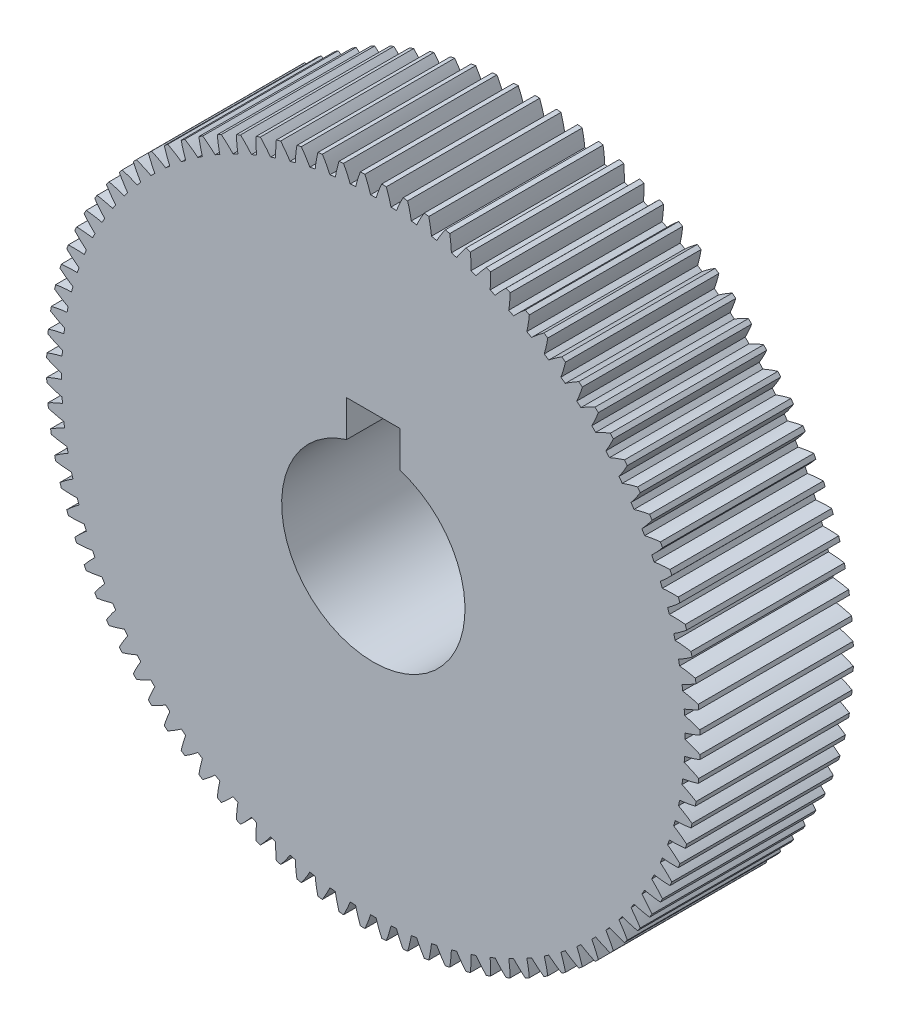
from build123d import *

# Parameters (mm, degrees)
EXTRUDE_1_DEPTH     = 46
CUT_EXTRUDE_1_DEPTH = 90


with BuildPart() as part:
    # Model → 凸台-拉伸1 (new body)
    with BuildSketch(Plane.XY):
        with BuildLine():
            ThreePointArc((-97.967489432, 2.524086835), (-95.758100973, 1.600439791), (-93.495436524, 0.816302804))
            ThreePointArc((-93.495436524, 0.816302804), (-93.499, 0), (-93.495436524, -0.816302804))
            ThreePointArc((-93.495436524, -0.816302804), (-95.758100973, -1.600439791), (-97.967489432, -2.524086835))
            ThreePointArc((-97.967489432, -2.524086835), (-97.947529573, -3.206470117), (-97.922816695, -3.8886978))
            ThreePointArc((-97.922816695, -3.8886978), (-95.657749299, -4.665866327), (-93.348644375, -5.300339081))
            ThreePointArc((-93.348644375, -5.300339081), (-93.298811464, -6.11512718), (-93.241866859, -6.929449154))
            ThreePointArc((-93.241866859, -6.929449154), (-95.448401758, -7.859892579), (-97.59265034, -8.926062943))
            ThreePointArc((-97.59265034, -8.926062943), (-97.528103214, -9.605679752), (-97.458823423, -10.284830434))
            ThreePointArc((-97.458823423, -10.284830434), (-95.147776456, -10.912192488), (-92.802119, -11.394284099))
            ThreePointArc((-92.802119, -11.394284099), (-92.699103094, -12.204068446), (-92.589021207, -13.012922539))
            ThreePointArc((-92.589021207, -13.012922539), (-94.729977833, -14.085688101), (-96.799904536, -15.289816279))
            ThreePointArc((-96.799904536, -15.289816279), (-96.691046544, -15.963756393), (-96.577496507, -16.636921846))
            ThreePointArc((-96.577496507, -16.636921846), (-94.230366228, -17.111790966), (-91.858200704, -17.439437044))
            ThreePointArc((-91.858200704, -17.439437044), (-91.702442932, -18.240750018), (-91.53969515, -19.040672593))
            ThreePointArc((-91.53969515, -19.040672593), (-93.6059056, -20.251166543), (-95.59264668, -21.588096275))
            ThreePointArc((-95.59264668, -21.588096275), (-95.439943969, -22.253473777), (-95.282609924, -22.917771404))
            ThreePointArc((-95.282609924, -22.917771404), (-92.909447105, -23.238114127), (-90.52093149, -23.409911642))
            ThreePointArc((-90.52093149, -23.409911642), (-90.313098832, -24.199321898), (-90.098382066, -24.986887563))
            ThreePointArc((-90.098382066, -24.986887563), (-92.080998508, -26.329926382), (-93.976046435, -27.793932728))
            ThreePointArc((-93.976046435, -27.793932728), (-93.780152902, -28.447898371), (-93.579708577, -29.100483546))
            ThreePointArc((-93.579708577, -29.100483546), (-91.190675465, -29.264928117), (-88.796037751, -29.280141405))
            ThreePointArc((-88.796037751, -29.280141405), (-88.537020178, -30.054268566), (-88.271253878, -30.826104844))
            ThreePointArc((-88.271253878, -30.826104844), (-90.161786444, -32.295937433), (-91.957026332, -33.880751294))
            ThreePointArc((-91.957026332, -33.880751294), (-91.718780822, -34.520504696), (-91.476084552, -35.158582951))
            ThreePointArc((-91.476084552, -35.158582951), (-89.081411354, -35.166425192), (-86.690905746, -35.024989107))
            ThreePointArc((-86.690905746, -35.024989107), (-86.38181241, -35.780518243), (-86.066134629, -36.533320012))
            ThreePointArc((-86.066134629, -36.533320012), (-87.856487769, -38.123652323), (-89.544232124, -39.822487281))
            ThreePointArc((-89.544232124, -39.822487281), (-89.264654842, -40.445288921), (-88.980745889, -41.066127905))
            ThreePointArc((-88.980745889, -41.066127905), (-86.590686963, -40.917334235), (-84.214549974, -40.619854428))
            ThreePointArc((-84.214549974, -40.619854428), (-83.856704461, -41.353550247), (-83.492466978, -42.084093895))
            ThreePointArc((-83.492466978, -42.084093895), (-85.174974125, -43.78811588), (-86.747995768, -45.593697265))
            ThreePointArc((-86.747995768, -45.593697265), (-86.428283906, -46.196880209), (-86.104378011, -46.797821395))
            ThreePointArc((-86.104378011, -46.797821395), (-83.729167956, -46.493028971), (-81.377574569, -46.040779297))
            ThreePointArc((-81.377574569, -46.040779297), (-80.972509228, -46.7495), (-80.561271766, -47.454657227))
            ThreePointArc((-80.561271766, -47.454657227), (-82.128728166, -49.265072003), (-83.580291176, -51.169668037))
            ThreePointArc((-83.580291176, -51.169668037), (-83.22181379, -51.750649364), (-82.859297968, -52.32911943))
            ThreePointArc((-82.859297968, -52.32911943), (-80.509107798, -51.869633419), (-78.192127897, -51.26455048))
            ThreePointArc((-78.192127897, -51.26455048), (-77.741577281, -51.945261217), (-77.28510082, -52.622012431))
            ThreePointArc((-77.28510082, -52.622012431), (-78.730794384, -54.531067523), (-80.054682945, -56.526522435))
            ThreePointArc((-80.054682945, -56.526522435), (-79.65897509, -57.082814293), (-79.25940169, -57.636336141))
            ThreePointArc((-79.25940169, -57.636336141), (-76.944295281, -57.024124134), (-74.671850529, -56.268798988))
            ThreePointArc((-74.671850529, -56.268798988), (-74.177743964, -56.918584851), (-73.677983207, -57.5640321))
            ThreePointArc((-73.677983207, -57.5640321), (-74.995723253, -59.563552641), (-76.186268272, -61.641321585))
            ThreePointArc((-76.186268272, -61.641321585), (-75.75502443, -62.170541848), (-75.320104486, -62.696745213))
            ThreePointArc((-75.320104486, -62.696745213), (-73.049995479, -61.934428794), (-70.831816834, -61.03209586))
            ThreePointArc((-70.831816834, -61.03209586), (-70.29627016, -61.648174366), (-69.755365159, -62.259553745))
            ThreePointArc((-69.755365159, -62.259553745), (-70.939508922, -64.340977483), (-71.991612302, -66.492163133))
            ThreePointArc((-71.991612302, -66.492163133), (-71.526679124, -66.992045598), (-71.058275031, -67.488677196))
            ThreePointArc((-71.058275031, -67.488677196), (-68.842884381, -66.579520723), (-66.688470424, -65.534043928))
            ThreePointArc((-66.688470424, -65.534043928), (-66.113776934, -66.113776934), (-65.534043928, -66.688470424))
            ThreePointArc((-65.534043928, -66.688470424), (-66.579520723, -68.842884381), (-67.488677196, -71.058275031))
            ThreePointArc((-67.488677196, -71.058275031), (-66.992045598, -71.526679124), (-66.492163133, -71.991612302))
            ThreePointArc((-66.492163133, -71.991612302), (-64.340977483, -70.939508922), (-62.259553746, -69.755365159))
            ThreePointArc((-62.259553746, -69.755365159), (-61.648174366, -70.296270159), (-61.03209586, -70.831816834))
            ThreePointArc((-61.03209586, -70.831816834), (-61.934428794, -73.049995479), (-62.696745213, -75.320104486))
            ThreePointArc((-62.696745213, -75.320104486), (-62.170541848, -75.75502443), (-61.641321585, -76.186268272))
            ThreePointArc((-61.641321585, -76.186268272), (-59.563552641, -74.995723253), (-57.5640321, -73.677983207))
            ThreePointArc((-57.5640321, -73.677983207), (-56.918584851, -74.177743964), (-56.268798988, -74.671850529))
            ThreePointArc((-56.268798988, -74.671850529), (-57.024124134, -76.944295281), (-57.636336141, -79.25940169))
            ThreePointArc((-57.636336141, -79.25940169), (-57.082814293, -79.65897509), (-56.526522435, -80.054682945))
            ThreePointArc((-56.526522435, -80.054682945), (-54.531067523, -78.730794384), (-52.622012431, -77.285100819))
            ThreePointArc((-52.622012431, -77.285100819), (-51.945261217, -77.741577281), (-51.26455048, -78.192127897))
            ThreePointArc((-51.26455048, -78.192127897), (-51.869633419, -80.509107798), (-52.32911943, -82.859297968))
            ThreePointArc((-52.32911943, -82.859297968), (-51.750649364, -83.22181379), (-51.169668037, -83.580291176))
            ThreePointArc((-51.169668037, -83.580291176), (-49.265072003, -82.128728166), (-47.454657227, -80.561271765))
            ThreePointArc((-47.454657227, -80.561271765), (-46.7495, -80.972509228), (-46.040779297, -81.377574569))
            ThreePointArc((-46.040779297, -81.377574569), (-46.493028971, -83.729167956), (-46.797821395, -86.104378011))
            ThreePointArc((-46.797821395, -86.104378011), (-46.196880209, -86.428283906), (-45.593697265, -86.747995768))
            ThreePointArc((-45.593697265, -86.747995768), (-43.78811588, -85.174974125), (-42.084093895, -83.492466978))
            ThreePointArc((-42.084093895, -83.492466978), (-41.353550247, -83.856704461), (-40.619854428, -84.214549974))
            ThreePointArc((-40.619854428, -84.214549974), (-40.917334235, -86.590686963), (-41.066127905, -88.980745888))
            ThreePointArc((-41.066127905, -88.980745888), (-40.445288921, -89.264654842), (-39.822487281, -89.544232124))
            ThreePointArc((-39.822487281, -89.544232124), (-38.123652323, -87.856487769), (-36.533320012, -86.066134629))
            ThreePointArc((-36.533320012, -86.066134629), (-35.780518243, -86.38181241), (-35.024989107, -86.690905746))
            ThreePointArc((-35.024989107, -86.690905746), (-35.166425192, -89.081411354), (-35.158582951, -91.476084552))
            ThreePointArc((-35.158582951, -91.476084552), (-34.520504696, -91.718780822), (-33.880751294, -91.957026332))
            ThreePointArc((-33.880751294, -91.957026332), (-32.295937434, -90.161786444), (-30.826104844, -88.271253878))
            ThreePointArc((-30.826104844, -88.271253878), (-30.054268566, -88.537020178), (-29.280141405, -88.796037751))
            ThreePointArc((-29.280141405, -88.796037751), (-29.264928117, -91.190675465), (-29.100483546, -93.579708577))
            ThreePointArc((-29.100483546, -93.579708577), (-28.447898371, -93.780152902), (-27.793932728, -93.976046435))
            ThreePointArc((-27.793932728, -93.976046435), (-26.329926382, -92.080998508), (-24.986887563, -90.098382066))
            ThreePointArc((-24.986887563, -90.098382066), (-24.199321898, -90.313098832), (-23.409911642, -90.52093149))
            ThreePointArc((-23.409911642, -90.52093149), (-23.238114128, -92.909447105), (-22.917771404, -95.282609924))
            ThreePointArc((-22.917771404, -95.282609924), (-22.253473777, -95.439943969), (-21.588096275, -95.59264668))
            ThreePointArc((-21.588096275, -95.59264668), (-20.251166543, -93.6059056), (-19.040672593, -91.53969515))
            ThreePointArc((-19.040672593, -91.53969515), (-18.240750018, -91.702442932), (-17.439437044, -91.858200704))
            ThreePointArc((-17.439437044, -91.858200704), (-17.111790966, -94.230366228), (-16.636921846, -96.577496507))
            ThreePointArc((-16.636921846, -96.577496507), (-15.963756393, -96.691046544), (-15.289816279, -96.799904536))
            ThreePointArc((-15.289816279, -96.799904536), (-14.085688101, -94.729977833), (-13.012922539, -92.589021207))
            ThreePointArc((-13.012922539, -92.589021207), (-12.204068446, -92.699103094), (-11.394284099, -92.802119))
            ThreePointArc((-11.394284099, -92.802119), (-10.912192488, -95.147776457), (-10.284830434, -97.458823423))
            ThreePointArc((-10.284830434, -97.458823423), (-9.605679752, -97.528103214), (-8.926062943, -97.59265034))
            ThreePointArc((-8.926062943, -97.59265034), (-7.859892579, -95.448401758), (-6.929449154, -93.241866859))
            ThreePointArc((-6.929449154, -93.241866859), (-6.11512718, -93.298811464), (-5.300339081, -93.348644375))
            ThreePointArc((-5.300339081, -93.348644375), (-4.665866327, -95.657749299), (-3.8886978, -97.922816695))
            ThreePointArc((-3.8886978, -97.922816695), (-3.206470117, -97.947529573), (-2.524086835, -97.967489432))
            ThreePointArc((-2.524086835, -97.967489432), (-1.600439791, -95.758100973), (-0.816302804, -93.495436524))
            ThreePointArc((-0.816302804, -93.495436524), (0, -93.499), (0.816302804, -93.495436524))
            ThreePointArc((0.816302804, -93.495436524), (1.600439791, -95.758100973), (2.524086835, -97.967489432))
            ThreePointArc((2.524086835, -97.967489432), (3.206470117, -97.947529573), (3.8886978, -97.922816695))
            ThreePointArc((3.8886978, -97.922816695), (4.665866327, -95.657749299), (5.300339081, -93.348644375))
            ThreePointArc((5.300339081, -93.348644375), (6.11512718, -93.298811464), (6.929449154, -93.241866859))
            ThreePointArc((6.929449154, -93.241866859), (7.859892579, -95.448401758), (8.926062943, -97.59265034))
            ThreePointArc((8.926062943, -97.59265034), (9.605679752, -97.528103214), (10.284830434, -97.458823423))
            ThreePointArc((10.284830434, -97.458823423), (10.912192488, -95.147776456), (11.394284099, -92.802119))
            ThreePointArc((11.394284099, -92.802119), (12.204068446, -92.699103094), (13.012922539, -92.589021207))
            ThreePointArc((13.012922539, -92.589021207), (14.085688101, -94.729977833), (15.289816279, -96.799904536))
            ThreePointArc((15.289816279, -96.799904536), (15.963756393, -96.691046544), (16.636921846, -96.577496507))
            ThreePointArc((16.636921846, -96.577496507), (17.111790966, -94.230366228), (17.439437044, -91.858200704))
            ThreePointArc((17.439437044, -91.858200704), (18.240750018, -91.702442932), (19.040672593, -91.53969515))
            ThreePointArc((19.040672593, -91.53969515), (20.251166543, -93.6059056), (21.588096275, -95.59264668))
            ThreePointArc((21.588096275, -95.59264668), (22.253473777, -95.439943969), (22.917771404, -95.282609924))
            ThreePointArc((22.917771404, -95.282609924), (23.238114127, -92.909447105), (23.409911642, -90.52093149))
            ThreePointArc((23.409911642, -90.52093149), (24.199321898, -90.313098832), (24.986887563, -90.098382066))
            ThreePointArc((24.986887563, -90.098382066), (26.329926382, -92.080998508), (27.793932728, -93.976046435))
            ThreePointArc((27.793932728, -93.976046435), (28.447898371, -93.780152902), (29.100483546, -93.579708577))
            ThreePointArc((29.100483546, -93.579708577), (29.264928117, -91.190675465), (29.280141405, -88.796037751))
            ThreePointArc((29.280141405, -88.796037751), (30.054268566, -88.537020178), (30.826104844, -88.271253878))
            ThreePointArc((30.826104844, -88.271253878), (32.295937433, -90.161786444), (33.880751294, -91.957026332))
            ThreePointArc((33.880751294, -91.957026332), (34.520504696, -91.718780822), (35.158582951, -91.476084552))
            ThreePointArc((35.158582951, -91.476084552), (35.166425192, -89.081411354), (35.024989107, -86.690905746))
            ThreePointArc((35.024989107, -86.690905746), (35.780518243, -86.38181241), (36.533320012, -86.066134629))
            ThreePointArc((36.533320012, -86.066134629), (38.123652323, -87.856487769), (39.822487281, -89.544232124))
            ThreePointArc((39.822487281, -89.544232124), (40.445288921, -89.264654842), (41.066127905, -88.980745889))
            ThreePointArc((41.066127905, -88.980745889), (40.917334235, -86.590686963), (40.619854428, -84.214549974))
            ThreePointArc((40.619854428, -84.214549974), (41.353550247, -83.856704461), (42.084093895, -83.492466978))
            ThreePointArc((42.084093895, -83.492466978), (43.78811588, -85.174974125), (45.593697265, -86.747995768))
            ThreePointArc((45.593697265, -86.747995768), (46.196880209, -86.428283906), (46.797821395, -86.104378011))
            ThreePointArc((46.797821395, -86.104378011), (46.493028971, -83.729167956), (46.040779297, -81.377574569))
            ThreePointArc((46.040779297, -81.377574569), (46.7495, -80.972509228), (47.454657227, -80.561271766))
            ThreePointArc((47.454657227, -80.561271766), (49.265072003, -82.128728166), (51.169668037, -83.580291176))
            ThreePointArc((51.169668037, -83.580291176), (51.750649364, -83.22181379), (52.32911943, -82.859297968))
            ThreePointArc((52.32911943, -82.859297968), (51.869633419, -80.509107798), (51.26455048, -78.192127897))
            ThreePointArc((51.26455048, -78.192127897), (51.945261217, -77.741577281), (52.622012431, -77.28510082))
            ThreePointArc((52.622012431, -77.28510082), (54.531067523, -78.730794384), (56.526522435, -80.054682945))
            ThreePointArc((56.526522435, -80.054682945), (57.082814293, -79.65897509), (57.636336141, -79.25940169))
            ThreePointArc((57.636336141, -79.25940169), (57.024124134, -76.944295281), (56.268798988, -74.671850529))
            ThreePointArc((56.268798988, -74.671850529), (56.918584851, -74.177743964), (57.5640321, -73.677983207))
            ThreePointArc((57.5640321, -73.677983207), (59.563552641, -74.995723253), (61.641321585, -76.186268272))
            ThreePointArc((61.641321585, -76.186268272), (62.170541848, -75.75502443), (62.696745213, -75.320104486))
            ThreePointArc((62.696745213, -75.320104486), (61.934428794, -73.049995479), (61.03209586, -70.831816834))
            ThreePointArc((61.03209586, -70.831816834), (61.648174366, -70.29627016), (62.259553745, -69.755365159))
            ThreePointArc((62.259553745, -69.755365159), (64.340977483, -70.939508922), (66.492163133, -71.991612302))
            ThreePointArc((66.492163133, -71.991612302), (66.992045598, -71.526679124), (67.488677196, -71.058275031))
            ThreePointArc((67.488677196, -71.058275031), (66.579520723, -68.842884381), (65.534043928, -66.688470424))
            ThreePointArc((65.534043928, -66.688470424), (66.113776934, -66.113776934), (66.688470424, -65.534043928))
            ThreePointArc((66.688470424, -65.534043928), (68.842884381, -66.579520723), (71.058275031, -67.488677196))
            ThreePointArc((71.058275031, -67.488677196), (71.526679124, -66.992045598), (71.991612302, -66.492163133))
            ThreePointArc((71.991612302, -66.492163133), (70.939508922, -64.340977483), (69.755365159, -62.259553746))
            ThreePointArc((69.755365159, -62.259553746), (70.296270159, -61.648174366), (70.831816834, -61.03209586))
            ThreePointArc((70.831816834, -61.03209586), (73.049995479, -61.934428794), (75.320104486, -62.696745213))
            ThreePointArc((75.320104486, -62.696745213), (75.75502443, -62.170541848), (76.186268272, -61.641321585))
            ThreePointArc((76.186268272, -61.641321585), (74.995723253, -59.563552641), (73.677983207, -57.5640321))
            ThreePointArc((73.677983207, -57.5640321), (74.177743964, -56.918584851), (74.671850529, -56.268798988))
            ThreePointArc((74.671850529, -56.268798988), (76.944295281, -57.024124134), (79.25940169, -57.636336141))
            ThreePointArc((79.25940169, -57.636336141), (79.65897509, -57.082814293), (80.054682945, -56.526522435))
            ThreePointArc((80.054682945, -56.526522435), (78.730794384, -54.531067523), (77.285100819, -52.622012431))
            ThreePointArc((77.285100819, -52.622012431), (77.741577281, -51.945261217), (78.192127897, -51.26455048))
            ThreePointArc((78.192127897, -51.26455048), (80.509107798, -51.869633419), (82.859297968, -52.32911943))
            ThreePointArc((82.859297968, -52.32911943), (83.22181379, -51.750649364), (83.580291176, -51.169668037))
            ThreePointArc((83.580291176, -51.169668037), (82.128728166, -49.265072003), (80.561271765, -47.454657227))
            ThreePointArc((80.561271765, -47.454657227), (80.972509228, -46.7495), (81.377574569, -46.040779297))
            ThreePointArc((81.377574569, -46.040779297), (83.729167956, -46.493028971), (86.104378011, -46.797821395))
            ThreePointArc((86.104378011, -46.797821395), (86.428283906, -46.196880209), (86.747995768, -45.593697265))
            ThreePointArc((86.747995768, -45.593697265), (85.174974125, -43.78811588), (83.492466978, -42.084093895))
            ThreePointArc((83.492466978, -42.084093895), (83.856704461, -41.353550247), (84.214549974, -40.619854428))
            ThreePointArc((84.214549974, -40.619854428), (86.590686963, -40.917334235), (88.980745888, -41.066127905))
            ThreePointArc((88.980745888, -41.066127905), (89.264654842, -40.445288921), (89.544232124, -39.822487281))
            ThreePointArc((89.544232124, -39.822487281), (87.856487769, -38.123652323), (86.066134629, -36.533320012))
            ThreePointArc((86.066134629, -36.533320012), (86.38181241, -35.780518243), (86.690905746, -35.024989107))
            ThreePointArc((86.690905746, -35.024989107), (89.081411354, -35.166425192), (91.476084552, -35.158582951))
            ThreePointArc((91.476084552, -35.158582951), (91.718780822, -34.520504696), (91.957026332, -33.880751294))
            ThreePointArc((91.957026332, -33.880751294), (90.161786444, -32.295937434), (88.271253878, -30.826104844))
            ThreePointArc((88.271253878, -30.826104844), (88.537020178, -30.054268566), (88.796037751, -29.280141405))
            ThreePointArc((88.796037751, -29.280141405), (91.190675465, -29.264928117), (93.579708577, -29.100483546))
            ThreePointArc((93.579708577, -29.100483546), (93.780152902, -28.447898371), (93.976046435, -27.793932728))
            ThreePointArc((93.976046435, -27.793932728), (92.080998508, -26.329926382), (90.098382066, -24.986887563))
            ThreePointArc((90.098382066, -24.986887563), (90.313098832, -24.199321898), (90.52093149, -23.409911642))
            ThreePointArc((90.52093149, -23.409911642), (92.909447105, -23.238114128), (95.282609924, -22.917771404))
            ThreePointArc((95.282609924, -22.917771404), (95.439943969, -22.253473777), (95.59264668, -21.588096275))
            ThreePointArc((95.59264668, -21.588096275), (93.6059056, -20.251166543), (91.53969515, -19.040672593))
            ThreePointArc((91.53969515, -19.040672593), (91.702442932, -18.240750018), (91.858200704, -17.439437044))
            ThreePointArc((91.858200704, -17.439437044), (94.230366228, -17.111790966), (96.577496507, -16.636921846))
            ThreePointArc((96.577496507, -16.636921846), (96.691046544, -15.963756393), (96.799904536, -15.289816279))
            ThreePointArc((96.799904536, -15.289816279), (94.729977833, -14.085688101), (92.589021207, -13.012922539))
            ThreePointArc((92.589021207, -13.012922539), (92.699103094, -12.204068446), (92.802119, -11.394284099))
            ThreePointArc((92.802119, -11.394284099), (95.147776456, -10.912192488), (97.458823423, -10.284830434))
            ThreePointArc((97.458823423, -10.284830434), (97.528103214, -9.605679752), (97.59265034, -8.926062943))
            ThreePointArc((97.59265034, -8.926062943), (95.448401758, -7.859892579), (93.241866859, -6.929449154))
            ThreePointArc((93.241866859, -6.929449154), (93.298811464, -6.11512718), (93.348644375, -5.300339081))
            ThreePointArc((93.348644375, -5.300339081), (95.657749299, -4.665866327), (97.922816695, -3.8886978))
            ThreePointArc((97.922816695, -3.8886978), (97.947529573, -3.206470117), (97.967489432, -2.524086835))
            ThreePointArc((97.967489432, -2.524086835), (95.758100973, -1.600439791), (93.495436524, -0.816302804))
            ThreePointArc((93.495436524, -0.816302804), (93.499, 0), (93.495436524, 0.816302804))
            ThreePointArc((93.495436524, 0.816302804), (95.758100973, 1.600439791), (97.967489432, 2.524086835))
            ThreePointArc((97.967489432, 2.524086835), (97.947529573, 3.206470117), (97.922816695, 3.8886978))
            ThreePointArc((97.922816695, 3.8886978), (95.657749299, 4.665866327), (93.348644375, 5.300339081))
            ThreePointArc((93.348644375, 5.300339081), (93.298811464, 6.11512718), (93.241866859, 6.929449154))
            ThreePointArc((93.241866859, 6.929449154), (95.448401758, 7.859892579), (97.59265034, 8.926062943))
            ThreePointArc((97.59265034, 8.926062943), (97.528103214, 9.605679752), (97.458823423, 10.284830434))
            ThreePointArc((97.458823423, 10.284830434), (95.147776456, 10.912192488), (92.802119, 11.394284099))
            ThreePointArc((92.802119, 11.394284099), (92.699103094, 12.204068446), (92.589021207, 13.012922539))
            ThreePointArc((92.589021207, 13.012922539), (94.729977833, 14.085688101), (96.799904536, 15.289816279))
            ThreePointArc((96.799904536, 15.289816279), (96.691046544, 15.963756393), (96.577496507, 16.636921846))
            ThreePointArc((96.577496507, 16.636921846), (94.230366228, 17.111790966), (91.858200704, 17.439437044))
            ThreePointArc((91.858200704, 17.439437044), (91.702442932, 18.240750018), (91.53969515, 19.040672593))
            ThreePointArc((91.53969515, 19.040672593), (93.6059056, 20.251166543), (95.59264668, 21.588096275))
            ThreePointArc((95.59264668, 21.588096275), (95.439943969, 22.253473777), (95.282609924, 22.917771404))
            ThreePointArc((95.282609924, 22.917771404), (92.909447105, 23.238114127), (90.52093149, 23.409911642))
            ThreePointArc((90.52093149, 23.409911642), (90.313098832, 24.199321898), (90.098382066, 24.986887563))
            ThreePointArc((90.098382066, 24.986887563), (92.080998508, 26.329926382), (93.976046435, 27.793932728))
            ThreePointArc((93.976046435, 27.793932728), (93.780152902, 28.447898371), (93.579708577, 29.100483546))
            ThreePointArc((93.579708577, 29.100483546), (91.190675465, 29.264928117), (88.796037751, 29.280141405))
            ThreePointArc((88.796037751, 29.280141405), (88.537020178, 30.054268566), (88.271253878, 30.826104844))
            ThreePointArc((88.271253878, 30.826104844), (90.161786444, 32.295937433), (91.957026332, 33.880751294))
            ThreePointArc((91.957026332, 33.880751294), (91.718780822, 34.520504696), (91.476084552, 35.158582951))
            ThreePointArc((91.476084552, 35.158582951), (89.081411354, 35.166425192), (86.690905746, 35.024989107))
            ThreePointArc((86.690905746, 35.024989107), (86.38181241, 35.780518243), (86.066134629, 36.533320012))
            ThreePointArc((86.066134629, 36.533320012), (87.856487769, 38.123652323), (89.544232124, 39.822487281))
            ThreePointArc((89.544232124, 39.822487281), (89.264654842, 40.445288921), (88.980745889, 41.066127905))
            ThreePointArc((88.980745889, 41.066127905), (86.590686963, 40.917334235), (84.214549974, 40.619854428))
            ThreePointArc((84.214549974, 40.619854428), (83.856704461, 41.353550247), (83.492466978, 42.084093895))
            ThreePointArc((83.492466978, 42.084093895), (85.174974125, 43.78811588), (86.747995768, 45.593697265))
            ThreePointArc((86.747995768, 45.593697265), (86.428283906, 46.196880209), (86.104378011, 46.797821395))
            ThreePointArc((86.104378011, 46.797821395), (83.729167956, 46.493028971), (81.377574569, 46.040779297))
            ThreePointArc((81.377574569, 46.040779297), (80.972509228, 46.7495), (80.561271766, 47.454657227))
            ThreePointArc((80.561271766, 47.454657227), (82.128728166, 49.265072003), (83.580291176, 51.169668037))
            ThreePointArc((83.580291176, 51.169668037), (83.22181379, 51.750649364), (82.859297968, 52.32911943))
            ThreePointArc((82.859297968, 52.32911943), (80.509107798, 51.869633419), (78.192127897, 51.26455048))
            ThreePointArc((78.192127897, 51.26455048), (77.741577281, 51.945261217), (77.28510082, 52.622012431))
            ThreePointArc((77.28510082, 52.622012431), (78.730794384, 54.531067523), (80.054682945, 56.526522435))
            ThreePointArc((80.054682945, 56.526522435), (79.65897509, 57.082814293), (79.25940169, 57.636336141))
            ThreePointArc((79.25940169, 57.636336141), (76.944295281, 57.024124134), (74.671850529, 56.268798988))
            ThreePointArc((74.671850529, 56.268798988), (74.177743964, 56.918584851), (73.677983207, 57.5640321))
            ThreePointArc((73.677983207, 57.5640321), (74.995723253, 59.563552641), (76.186268272, 61.641321585))
            ThreePointArc((76.186268272, 61.641321585), (75.75502443, 62.170541848), (75.320104486, 62.696745213))
            ThreePointArc((75.320104486, 62.696745213), (73.049995479, 61.934428794), (70.831816834, 61.03209586))
            ThreePointArc((70.831816834, 61.03209586), (70.29627016, 61.648174366), (69.755365159, 62.259553745))
            ThreePointArc((69.755365159, 62.259553745), (70.939508922, 64.340977483), (71.991612302, 66.492163133))
            ThreePointArc((71.991612302, 66.492163133), (71.526679124, 66.992045598), (71.058275031, 67.488677196))
            ThreePointArc((71.058275031, 67.488677196), (68.842884381, 66.579520723), (66.688470424, 65.534043928))
            ThreePointArc((66.688470424, 65.534043928), (66.113776934, 66.113776934), (65.534043928, 66.688470424))
            ThreePointArc((65.534043928, 66.688470424), (66.579520723, 68.842884381), (67.488677196, 71.058275031))
            ThreePointArc((67.488677196, 71.058275031), (66.992045598, 71.526679124), (66.492163133, 71.991612302))
            ThreePointArc((66.492163133, 71.991612302), (64.340977483, 70.939508922), (62.259553746, 69.755365159))
            ThreePointArc((62.259553746, 69.755365159), (61.648174366, 70.296270159), (61.03209586, 70.831816834))
            ThreePointArc((61.03209586, 70.831816834), (61.934428794, 73.049995479), (62.696745213, 75.320104486))
            ThreePointArc((62.696745213, 75.320104486), (62.170541848, 75.75502443), (61.641321585, 76.186268272))
            ThreePointArc((61.641321585, 76.186268272), (59.563552641, 74.995723253), (57.5640321, 73.677983207))
            ThreePointArc((57.5640321, 73.677983207), (56.918584851, 74.177743964), (56.268798988, 74.671850529))
            ThreePointArc((56.268798988, 74.671850529), (57.024124134, 76.944295281), (57.636336141, 79.25940169))
            ThreePointArc((57.636336141, 79.25940169), (57.082814293, 79.65897509), (56.526522435, 80.054682945))
            ThreePointArc((56.526522435, 80.054682945), (54.531067523, 78.730794384), (52.622012431, 77.285100819))
            ThreePointArc((52.622012431, 77.285100819), (51.945261217, 77.741577281), (51.26455048, 78.192127897))
            ThreePointArc((51.26455048, 78.192127897), (51.869633419, 80.509107798), (52.32911943, 82.859297968))
            ThreePointArc((52.32911943, 82.859297968), (51.750649364, 83.22181379), (51.169668037, 83.580291176))
            ThreePointArc((51.169668037, 83.580291176), (49.265072003, 82.128728166), (47.454657227, 80.561271765))
            ThreePointArc((47.454657227, 80.561271765), (46.7495, 80.972509228), (46.040779297, 81.377574569))
            ThreePointArc((46.040779297, 81.377574569), (46.493028971, 83.729167956), (46.797821395, 86.104378011))
            ThreePointArc((46.797821395, 86.104378011), (46.196880209, 86.428283906), (45.593697265, 86.747995768))
            ThreePointArc((45.593697265, 86.747995768), (43.78811588, 85.174974125), (42.084093895, 83.492466978))
            ThreePointArc((42.084093895, 83.492466978), (41.353550247, 83.856704461), (40.619854428, 84.214549974))
            ThreePointArc((40.619854428, 84.214549974), (40.917334235, 86.590686963), (41.066127905, 88.980745888))
            ThreePointArc((41.066127905, 88.980745888), (40.445288921, 89.264654842), (39.822487281, 89.544232124))
            ThreePointArc((39.822487281, 89.544232124), (38.123652323, 87.856487769), (36.533320012, 86.066134629))
            ThreePointArc((36.533320012, 86.066134629), (35.780518243, 86.38181241), (35.024989107, 86.690905746))
            ThreePointArc((35.024989107, 86.690905746), (35.166425192, 89.081411354), (35.158582951, 91.476084552))
            ThreePointArc((35.158582951, 91.476084552), (34.520504696, 91.718780822), (33.880751294, 91.957026332))
            ThreePointArc((33.880751294, 91.957026332), (32.295937434, 90.161786444), (30.826104844, 88.271253878))
            ThreePointArc((30.826104844, 88.271253878), (30.054268566, 88.537020178), (29.280141405, 88.796037751))
            ThreePointArc((29.280141405, 88.796037751), (29.264928117, 91.190675465), (29.100483546, 93.579708577))
            ThreePointArc((29.100483546, 93.579708577), (28.447898371, 93.780152902), (27.793932728, 93.976046435))
            ThreePointArc((27.793932728, 93.976046435), (26.329926382, 92.080998508), (24.986887563, 90.098382066))
            ThreePointArc((24.986887563, 90.098382066), (24.199321898, 90.313098832), (23.409911642, 90.52093149))
            ThreePointArc((23.409911642, 90.52093149), (23.238114128, 92.909447105), (22.917771404, 95.282609924))
            ThreePointArc((22.917771404, 95.282609924), (22.253473777, 95.439943969), (21.588096275, 95.59264668))
            ThreePointArc((21.588096275, 95.59264668), (20.251166543, 93.6059056), (19.040672593, 91.53969515))
            ThreePointArc((19.040672593, 91.53969515), (18.240750018, 91.702442932), (17.439437044, 91.858200704))
            ThreePointArc((17.439437044, 91.858200704), (17.111790966, 94.230366228), (16.636921846, 96.577496507))
            ThreePointArc((16.636921846, 96.577496507), (15.963756393, 96.691046544), (15.289816279, 96.799904536))
            ThreePointArc((15.289816279, 96.799904536), (14.085688101, 94.729977833), (13.012922539, 92.589021207))
            ThreePointArc((13.012922539, 92.589021207), (12.204068446, 92.699103094), (11.394284099, 92.802119))
            ThreePointArc((11.394284099, 92.802119), (10.912192488, 95.147776457), (10.284830434, 97.458823423))
            ThreePointArc((10.284830434, 97.458823423), (9.605679752, 97.528103214), (8.926062943, 97.59265034))
            ThreePointArc((8.926062943, 97.59265034), (7.859892579, 95.448401758), (6.929449154, 93.241866859))
            ThreePointArc((6.929449154, 93.241866859), (6.11512718, 93.298811464), (5.300339081, 93.348644375))
            ThreePointArc((5.300339081, 93.348644375), (4.665866327, 95.657749299), (3.8886978, 97.922816695))
            ThreePointArc((3.8886978, 97.922816695), (3.206470117, 97.947529573), (2.524086835, 97.967489432))
            ThreePointArc((2.524086835, 97.967489432), (1.600439791, 95.758100973), (0.816302804, 93.495436524))
            ThreePointArc((0.816302804, 93.495436524), (0, 93.499), (-0.816302804, 93.495436524))
            ThreePointArc((-0.816302804, 93.495436524), (-1.600439791, 95.758100973), (-2.524086835, 97.967489432))
            ThreePointArc((-2.524086835, 97.967489432), (-3.206470117, 97.947529573), (-3.8886978, 97.922816695))
            ThreePointArc((-3.8886978, 97.922816695), (-4.665866327, 95.657749299), (-5.300339081, 93.348644375))
            ThreePointArc((-5.300339081, 93.348644375), (-6.11512718, 93.298811464), (-6.929449154, 93.241866859))
            ThreePointArc((-6.929449154, 93.241866859), (-7.859892579, 95.448401758), (-8.926062943, 97.59265034))
            ThreePointArc((-8.926062943, 97.59265034), (-9.605679752, 97.528103214), (-10.284830434, 97.458823423))
            ThreePointArc((-10.284830434, 97.458823423), (-10.912192488, 95.147776456), (-11.394284099, 92.802119))
            ThreePointArc((-11.394284099, 92.802119), (-12.204068446, 92.699103094), (-13.012922539, 92.589021207))
            ThreePointArc((-13.012922539, 92.589021207), (-14.085688101, 94.729977833), (-15.289816279, 96.799904536))
            ThreePointArc((-15.289816279, 96.799904536), (-15.963756393, 96.691046544), (-16.636921846, 96.577496507))
            ThreePointArc((-16.636921846, 96.577496507), (-17.111790966, 94.230366228), (-17.439437044, 91.858200704))
            ThreePointArc((-17.439437044, 91.858200704), (-18.240750018, 91.702442932), (-19.040672593, 91.53969515))
            ThreePointArc((-19.040672593, 91.53969515), (-20.251166543, 93.6059056), (-21.588096275, 95.59264668))
            ThreePointArc((-21.588096275, 95.59264668), (-22.253473777, 95.439943969), (-22.917771404, 95.282609924))
            ThreePointArc((-22.917771404, 95.282609924), (-23.238114127, 92.909447105), (-23.409911642, 90.52093149))
            ThreePointArc((-23.409911642, 90.52093149), (-24.199321898, 90.313098832), (-24.986887563, 90.098382066))
            ThreePointArc((-24.986887563, 90.098382066), (-26.329926382, 92.080998508), (-27.793932728, 93.976046435))
            ThreePointArc((-27.793932728, 93.976046435), (-28.447898371, 93.780152902), (-29.100483546, 93.579708577))
            ThreePointArc((-29.100483546, 93.579708577), (-29.264928117, 91.190675465), (-29.280141405, 88.796037751))
            ThreePointArc((-29.280141405, 88.796037751), (-30.054268566, 88.537020178), (-30.826104844, 88.271253878))
            ThreePointArc((-30.826104844, 88.271253878), (-32.295937433, 90.161786444), (-33.880751294, 91.957026332))
            ThreePointArc((-33.880751294, 91.957026332), (-34.520504696, 91.718780822), (-35.158582951, 91.476084552))
            ThreePointArc((-35.158582951, 91.476084552), (-35.166425192, 89.081411354), (-35.024989107, 86.690905746))
            ThreePointArc((-35.024989107, 86.690905746), (-35.780518243, 86.38181241), (-36.533320012, 86.066134629))
            ThreePointArc((-36.533320012, 86.066134629), (-38.123652323, 87.856487769), (-39.822487281, 89.544232124))
            ThreePointArc((-39.822487281, 89.544232124), (-40.445288921, 89.264654842), (-41.066127905, 88.980745889))
            ThreePointArc((-41.066127905, 88.980745889), (-40.917334235, 86.590686963), (-40.619854428, 84.214549974))
            ThreePointArc((-40.619854428, 84.214549974), (-41.353550247, 83.856704461), (-42.084093895, 83.492466978))
            ThreePointArc((-42.084093895, 83.492466978), (-43.78811588, 85.174974125), (-45.593697265, 86.747995768))
            ThreePointArc((-45.593697265, 86.747995768), (-46.196880209, 86.428283906), (-46.797821395, 86.104378011))
            ThreePointArc((-46.797821395, 86.104378011), (-46.493028971, 83.729167956), (-46.040779297, 81.377574569))
            ThreePointArc((-46.040779297, 81.377574569), (-46.7495, 80.972509228), (-47.454657227, 80.561271766))
            ThreePointArc((-47.454657227, 80.561271766), (-49.265072003, 82.128728166), (-51.169668037, 83.580291176))
            ThreePointArc((-51.169668037, 83.580291176), (-51.750649364, 83.22181379), (-52.32911943, 82.859297968))
            ThreePointArc((-52.32911943, 82.859297968), (-51.869633419, 80.509107798), (-51.26455048, 78.192127897))
            ThreePointArc((-51.26455048, 78.192127897), (-51.945261217, 77.741577281), (-52.622012431, 77.28510082))
            ThreePointArc((-52.622012431, 77.28510082), (-54.531067523, 78.730794384), (-56.526522435, 80.054682945))
            ThreePointArc((-56.526522435, 80.054682945), (-57.082814293, 79.65897509), (-57.636336141, 79.25940169))
            ThreePointArc((-57.636336141, 79.25940169), (-57.024124134, 76.944295281), (-56.268798988, 74.671850529))
            ThreePointArc((-56.268798988, 74.671850529), (-56.918584851, 74.177743964), (-57.5640321, 73.677983207))
            ThreePointArc((-57.5640321, 73.677983207), (-59.563552641, 74.995723253), (-61.641321585, 76.186268272))
            ThreePointArc((-61.641321585, 76.186268272), (-62.170541848, 75.75502443), (-62.696745213, 75.320104486))
            ThreePointArc((-62.696745213, 75.320104486), (-61.934428794, 73.049995479), (-61.03209586, 70.831816834))
            ThreePointArc((-61.03209586, 70.831816834), (-61.648174366, 70.29627016), (-62.259553745, 69.755365159))
            ThreePointArc((-62.259553745, 69.755365159), (-64.340977483, 70.939508922), (-66.492163133, 71.991612302))
            ThreePointArc((-66.492163133, 71.991612302), (-66.992045598, 71.526679124), (-67.488677196, 71.058275031))
            ThreePointArc((-67.488677196, 71.058275031), (-66.579520723, 68.842884381), (-65.534043928, 66.688470424))
            ThreePointArc((-65.534043928, 66.688470424), (-66.113776934, 66.113776934), (-66.688470424, 65.534043928))
            ThreePointArc((-66.688470424, 65.534043928), (-68.842884381, 66.579520723), (-71.058275031, 67.488677196))
            ThreePointArc((-71.058275031, 67.488677196), (-71.526679124, 66.992045598), (-71.991612302, 66.492163133))
            ThreePointArc((-71.991612302, 66.492163133), (-70.939508922, 64.340977483), (-69.755365159, 62.259553746))
            ThreePointArc((-69.755365159, 62.259553746), (-70.296270159, 61.648174366), (-70.831816834, 61.03209586))
            ThreePointArc((-70.831816834, 61.03209586), (-73.049995479, 61.934428794), (-75.320104486, 62.696745213))
            ThreePointArc((-75.320104486, 62.696745213), (-75.75502443, 62.170541848), (-76.186268272, 61.641321585))
            ThreePointArc((-76.186268272, 61.641321585), (-74.995723253, 59.563552641), (-73.677983207, 57.5640321))
            ThreePointArc((-73.677983207, 57.5640321), (-74.177743964, 56.918584851), (-74.671850529, 56.268798988))
            ThreePointArc((-74.671850529, 56.268798988), (-76.944295281, 57.024124134), (-79.25940169, 57.636336141))
            ThreePointArc((-79.25940169, 57.636336141), (-79.65897509, 57.082814293), (-80.054682945, 56.526522435))
            ThreePointArc((-80.054682945, 56.526522435), (-78.730794384, 54.531067523), (-77.285100819, 52.622012431))
            ThreePointArc((-77.285100819, 52.622012431), (-77.741577281, 51.945261217), (-78.192127897, 51.26455048))
            ThreePointArc((-78.192127897, 51.26455048), (-80.509107798, 51.869633419), (-82.859297968, 52.32911943))
            ThreePointArc((-82.859297968, 52.32911943), (-83.22181379, 51.750649364), (-83.580291176, 51.169668037))
            ThreePointArc((-83.580291176, 51.169668037), (-82.128728166, 49.265072003), (-80.561271765, 47.454657227))
            ThreePointArc((-80.561271765, 47.454657227), (-80.972509228, 46.7495), (-81.377574569, 46.040779297))
            ThreePointArc((-81.377574569, 46.040779297), (-83.729167956, 46.493028971), (-86.104378011, 46.797821395))
            ThreePointArc((-86.104378011, 46.797821395), (-86.428283906, 46.196880209), (-86.747995768, 45.593697265))
            ThreePointArc((-86.747995768, 45.593697265), (-85.174974125, 43.78811588), (-83.492466978, 42.084093895))
            ThreePointArc((-83.492466978, 42.084093895), (-83.856704461, 41.353550247), (-84.214549974, 40.619854428))
            ThreePointArc((-84.214549974, 40.619854428), (-86.590686963, 40.917334235), (-88.980745888, 41.066127905))
            ThreePointArc((-88.980745888, 41.066127905), (-89.264654842, 40.445288921), (-89.544232124, 39.822487281))
            ThreePointArc((-89.544232124, 39.822487281), (-87.856487769, 38.123652323), (-86.066134629, 36.533320012))
            ThreePointArc((-86.066134629, 36.533320012), (-86.38181241, 35.780518243), (-86.690905746, 35.024989107))
            ThreePointArc((-86.690905746, 35.024989107), (-89.081411354, 35.166425192), (-91.476084552, 35.158582951))
            ThreePointArc((-91.476084552, 35.158582951), (-91.718780822, 34.520504696), (-91.957026332, 33.880751294))
            ThreePointArc((-91.957026332, 33.880751294), (-90.161786444, 32.295937434), (-88.271253878, 30.826104844))
            ThreePointArc((-88.271253878, 30.826104844), (-88.537020178, 30.054268566), (-88.796037751, 29.280141405))
            ThreePointArc((-88.796037751, 29.280141405), (-91.190675465, 29.264928117), (-93.579708577, 29.100483546))
            ThreePointArc((-93.579708577, 29.100483546), (-93.780152902, 28.447898371), (-93.976046435, 27.793932728))
            ThreePointArc((-93.976046435, 27.793932728), (-92.080998508, 26.329926382), (-90.098382066, 24.986887563))
            ThreePointArc((-90.098382066, 24.986887563), (-90.313098832, 24.199321898), (-90.52093149, 23.409911642))
            ThreePointArc((-90.52093149, 23.409911642), (-92.909447105, 23.238114128), (-95.282609924, 22.917771404))
            ThreePointArc((-95.282609924, 22.917771404), (-95.439943969, 22.253473777), (-95.59264668, 21.588096275))
            ThreePointArc((-95.59264668, 21.588096275), (-93.6059056, 20.251166543), (-91.53969515, 19.040672593))
            ThreePointArc((-91.53969515, 19.040672593), (-91.702442932, 18.240750018), (-91.858200704, 17.439437044))
            ThreePointArc((-91.858200704, 17.439437044), (-94.230366228, 17.111790966), (-96.577496507, 16.636921846))
            ThreePointArc((-96.577496507, 16.636921846), (-96.691046544, 15.963756393), (-96.799904536, 15.289816279))
            ThreePointArc((-96.799904536, 15.289816279), (-94.729977833, 14.085688101), (-92.589021207, 13.012922539))
            ThreePointArc((-92.589021207, 13.012922539), (-92.699103094, 12.204068446), (-92.802119, 11.394284099))
            ThreePointArc((-92.802119, 11.394284099), (-95.147776457, 10.912192488), (-97.458823423, 10.284830434))
            ThreePointArc((-97.458823423, 10.284830434), (-97.528103214, 9.605679752), (-97.59265034, 8.926062943))
            ThreePointArc((-97.59265034, 8.926062943), (-95.448401758, 7.859892579), (-93.241866859, 6.929449154))
            ThreePointArc((-93.241866859, 6.929449154), (-93.298811464, 6.11512718), (-93.348644375, 5.300339081))
            ThreePointArc((-93.348644375, 5.300339081), (-95.657749299, 4.665866327), (-97.922816695, 3.8886978))
            ThreePointArc((-97.922816695, 3.8886978), (-97.947529573, 3.206470117), (-97.967489432, 2.524086835))
        make_face()
        with BuildLine():
            Line((6, 19.078784028), (6, 23.3))
            Line((6, 23.3), (-6, 23.3))
            Line((-6, 23.3), (-6, 19.078784028))
            ThreePointArc((-6, 19.078784028), (0, -20), (6, 19.078784028))
        make_face(mode=Mode.SUBTRACT)
    extrude(amount=EXTRUDE_1_DEPTH)

    # 草图1 → 切除-拉伸1 (cut)
    with BuildSketch(Plane.XY.offset(46)):
        with BuildLine():
            Line((-8, 37.2), (-8, 26.310644234))
            ThreePointArc((-8, 26.310644234), (0, -27.5), (8, 26.310644234))
            Line((8, 26.310644234), (8, 37.2))
            Line((8, 37.2), (-8, 37.2))
        make_face()
    extrude(amount=-CUT_EXTRUDE_1_DEPTH, mode=Mode.SUBTRACT)


solid = part.part
